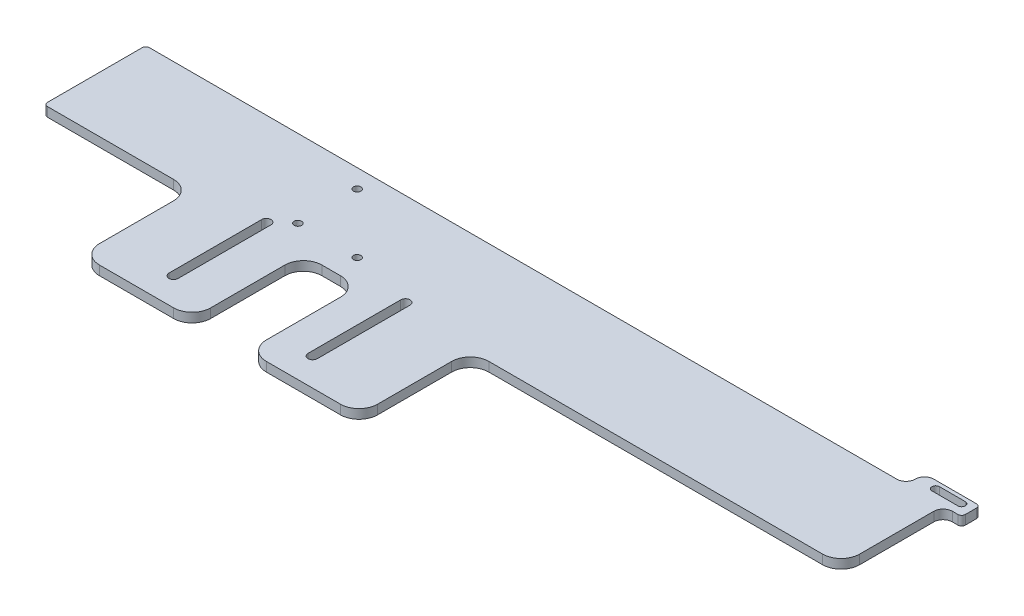
from build123d import *

# Parameters (mm, degrees)
SKETCH1_R           = 2
BOSS_EXTRUDE1_DEPTH = 5
SKETCH2_W           = 30
SKETCH2_H           = 10
BOSS_EXTRUDE2_DEPTH = 5
CUT_EXTRUDE1_DEPTH  = 315.880929877
FILLET1_R           = 5
SKETCH4_W           = 60
SKETCH4_H           = 60
BOSS_EXTRUDE3_DEPTH = 5
FILLET2_R           = 10
FILLET3_R           = 10
FILLET4_R           = 2
FILLET5_R           = 2
FILLET6_R           = 10
CUT_EXTRUDE2_DEPTH  = 331.681115276


with BuildPart() as part:
    # Sketch1 → Boss-Extrude1 (new body)
    with BuildSketch(Plane(origin=(0, 0, 0), x_dir=(1, 0, 0), z_dir=(0, 1, 0))):
        Polygon((0, 0), (-130, 0), (-130, -55), (300, -55), (300, 0), align=None)
        with Locations(Location((-6, -10, 0), (0, 0, 270))):
            Circle(SKETCH1_R, mode=Mode.SUBTRACT)
        with Locations(Location((-6, -42, 0), (0, 0, 90))):
            Circle(SKETCH1_R, mode=Mode.SUBTRACT)
        with Locations(Location((26, -42, 0), (0, 0, 270))):
            Circle(SKETCH1_R, mode=Mode.SUBTRACT)
    extrude(amount=BOSS_EXTRUDE1_DEPTH)

    # Sketch2 → Boss-Extrude2 (add)
    with BuildSketch(Plane(origin=(0, 5, 0), x_dir=(1, 0, 0), z_dir=(0, 1, 0))):
        with Locations((295, 5)):
            Rectangle(SKETCH2_W, SKETCH2_H)
    extrude(amount=-BOSS_EXTRUDE2_DEPTH)

    # Sketch3 → Cut-Extrude1 (cut, through all)
    with BuildSketch(Plane(origin=(0, 5, 0), x_dir=(1, 0, 0), z_dir=(0, 1, 0))):
        with BuildLine():
            Line((290, 8), (304, 8))
            ThreePointArc((304, 8), (306, 6), (304, 4))
            Line((304, 4), (290, 4))
            ThreePointArc((290, 4), (288, 6), (290, 8))
        make_face()
    extrude(amount=-CUT_EXTRUDE1_DEPTH, mode=Mode.SUBTRACT)

    # Fillet1
    fillet1_edges = [part.edges().sort_by_distance(p)[0] for p in [
        (300, 2.5, 0),
        (280, 2.5, -10),
        (280, 2.5, 0),
    ]]
    fillet(fillet1_edges, radius=FILLET1_R - 0.0001)  # a hair under: the kernel refuses the full size

    # Sketch4 → Boss-Extrude3 (add)
    with BuildSketch(Plane(origin=(0, 5, 0), x_dir=(1, 0, 0), z_dir=(0, 1, 0))):
        with Locations((70, -85)):
            Rectangle(SKETCH4_W, SKETCH4_H)
        with Locations((-20, -85)):
            Rectangle(SKETCH4_W, SKETCH4_H)
    extrude(amount=-BOSS_EXTRUDE3_DEPTH)

    # Fillet2
    fillet2_edges = [part.edges().sort_by_distance(p)[0] for p in [
        (40, 2.5, 55),
        (100, 2.5, 55),
        (100, 2.5, 115),
        (40, 2.5, 115),
    ]]
    fillet(fillet2_edges, radius=FILLET2_R)

    # Fillet3
    fillet3_edges = [part.edges().sort_by_distance(p)[0] for p in [
        (300, 2.5, 55),
    ]]
    fillet(fillet3_edges, radius=FILLET3_R)

    # Fillet4
    fillet4_edges = [part.edges().sort_by_distance(p)[0] for p in [
        (310, 2.5, -10),
        (310, 2.5, 0),
    ]]
    fillet(fillet4_edges, radius=FILLET4_R)

    # Fillet5
    fillet5_edges = [part.edges().sort_by_distance(p)[0] for p in [
        (-130, 2.5, 55),
        (-130, 2.5, 0),
    ]]
    fillet(fillet5_edges, radius=FILLET5_R)

    # Fillet6
    fillet6_edges = [part.edges().sort_by_distance(p)[0] for p in [
        (10, 2.5, 55),
        (10, 2.5, 115),
        (-50, 2.5, 115),
        (-50, 2.5, 55),
    ]]
    fillet(fillet6_edges, radius=FILLET6_R)

    # Sketch6 → Cut-Extrude2 (cut, through all)
    with BuildSketch(Plane(origin=(0, 5, 0), x_dir=(1, 0, 0), z_dir=(0, 1, 0))):
        with BuildLine():
            Line((-17.5, -100), (-17.5, -50))
            ThreePointArc((-17.5, -50), (-15, -47.5), (-12.5, -50))
            Line((-12.5, -50), (-12.5, -100))
            ThreePointArc((-12.5, -100), (-15, -102.5), (-17.5, -100))
        make_face()
        with BuildLine():
            Line((57.5, -100), (57.5, -50))
            ThreePointArc((57.5, -50), (60, -47.5), (62.5, -50))
            Line((62.5, -50), (62.5, -100))
            ThreePointArc((62.5, -100), (60, -102.5), (57.5, -100))
        make_face()
    extrude(amount=-CUT_EXTRUDE2_DEPTH, mode=Mode.SUBTRACT)


solid = part.part
